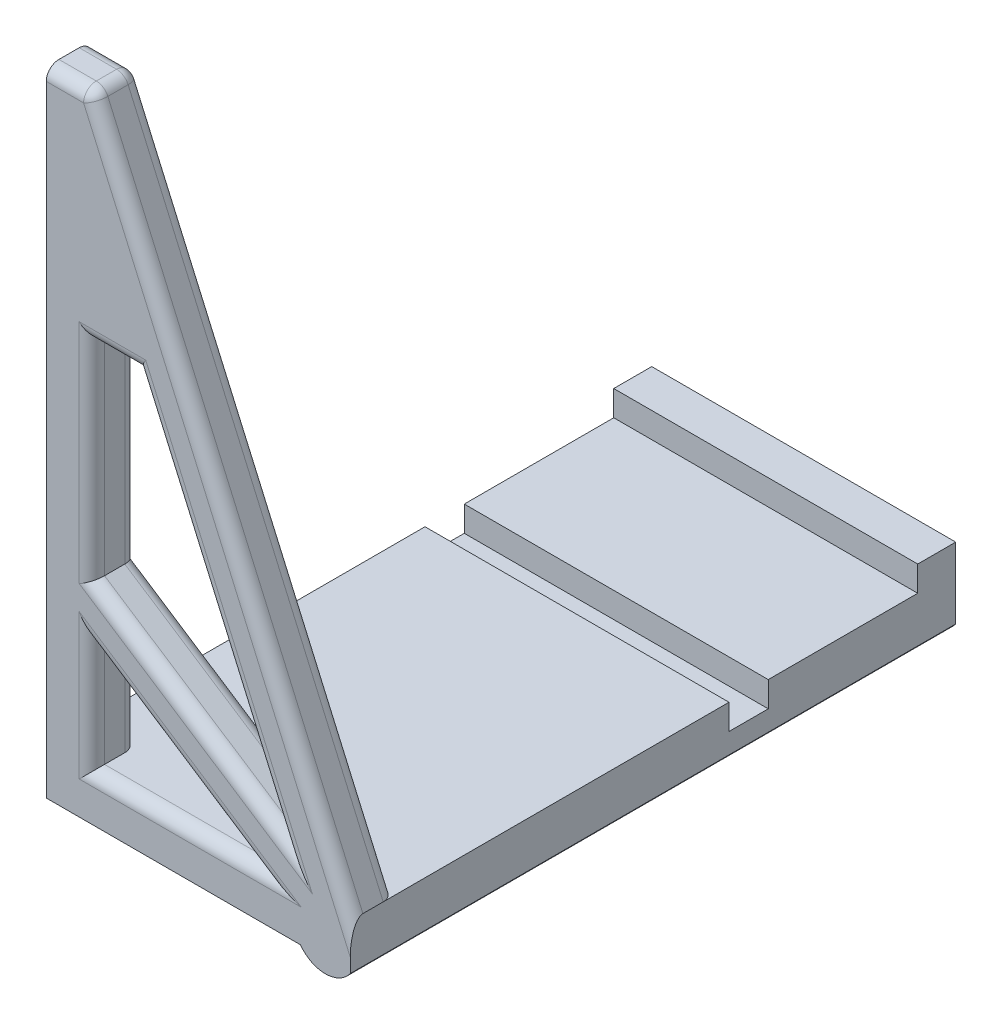
from build123d import *

# Parameters (mm, degrees)
EXTRUDE_1_DEPTH     = 120
SKETCH_2_W          = 15.5
SKETCH_2_H          = 10
CUT_EXTRUDE_1_DEPTH = 324.916484435
CUT_EXTRUDE_2_DEPTH = 40
CUT_EXTRUDE_3_DEPTH = 40
FILLET_16_R         = 5
EXTRUDE_2_DEPTH     = 239
EXTRUDE_3_DEPTH     = 18
FILLET_17_R         = 5


with BuildPart() as part:
    # 草圖1 → 填料-伸長1 (new body)
    with BuildSketch(Plane(origin=(0, 0, 0), x_dir=(0, 0, -1), z_dir=(1, 0, 0))):
        Polygon((-179.666666667, 241.333333333), (-179.666666667, -8.666666667), (59.333333333, -8.666666667), (59.333333333, 9.333333333), (59.333333333, 19.333333333), (44.333333333, 19.333333333), (44.333333333, 9.333333333), (-161.666666667, 9.333333333), (-161.666666667, 241.333333333), align=None)
    extrude(amount=EXTRUDE_1_DEPTH)

    # 草圖2 → 除料-伸長1 (cut, through all)
    with BuildSketch(Plane(origin=(120, 0, 0), x_dir=(0, 0, -1), z_dir=(1, 0, 0))):
        with Locations((-22.416666667, 4.333333333)):
            Rectangle(SKETCH_2_W, SKETCH_2_H)
    extrude(amount=-CUT_EXTRUDE_1_DEPTH, mode=Mode.SUBTRACT)

    # 草圖4 → 除料-伸長2 (cut)
    with BuildSketch(Plane.XY.offset(179.666666667)):
        Polygon((120, 241.333333333), (18, 241.333333333), (120, 9.333333333), align=None)
    extrude(amount=-CUT_EXTRUDE_2_DEPTH, mode=Mode.SUBTRACT)

    # 草圖5 → 除料-伸長3 (cut)
    with BuildSketch(Plane.XY.offset(179.666666667)):
        Polygon((36, 155.668785671), (100.337138528, 9.333333333), (18, 9.333333333), (18, 155.668785671), align=None)
    extrude(amount=-CUT_EXTRUDE_3_DEPTH, mode=Mode.SUBTRACT)

    # 圓角16
    # the kernel refuses this fillet: 5 mm, written as the material it takes off along each edge
    with BuildSketch(Plane(origin=(14.736369898, 236.333333333, 166.666666667), x_dir=(0.9154313590233789, 0.40247413198441667, 0), z_dir=(0, 0, -1))) as fillet_16_piece_1_section:
        Polygon((0, 0), (FILLET_16_R, 0), (FILLET_16_R, -FILLET_16_R * 0.652726020499), (FILLET_16_R * 0.402474131984, -FILLET_16_R * 0.915431359023), align=None)
    fillet_16_piece_1 = extrude(amount=FILLET_16_R, mode=Mode.PRIVATE)
    fillet_16_piece_1 = fillet_16_piece_1 - Plane(origin=(14.736369898, 236.333333333, 166.666666667), x_dir=(-0.5465921093537591, -0.8373989885306815, 0), z_dir=(0, 0, -1)) * Sphere(FILLET_16_R, mode=Mode.PRIVATE)
    add(fillet_16_piece_1, mode=Mode.SUBTRACT)
    with BuildSketch(Plane(origin=(14.736369898, 236.333333333, 174.666666667), x_dir=(0, 1, 0), z_dir=(0, 0, 1))) as fillet_16_piece_2_section:
        Polygon((0, 0), (FILLET_16_R, 0), (FILLET_16_R, -FILLET_16_R * 0.652726020499), (FILLET_16_R * 0.402474131984, -FILLET_16_R * 0.915431359023), align=None)
    fillet_16_piece_2 = extrude(amount=FILLET_16_R, mode=Mode.PRIVATE)
    fillet_16_piece_2 = fillet_16_piece_2 - Plane(origin=(14.736369898, 236.333333333, 174.666666667), x_dir=(-0.5465921093537591, -0.8373989885306815, 0), z_dir=(0, 0, 1)) * Sphere(FILLET_16_R, mode=Mode.PRIVATE)
    add(fillet_16_piece_2, mode=Mode.SUBTRACT)
    with BuildSketch(Plane(origin=(-12.5, 241.333333333, 161.666666667), x_dir=(0, 0, 1), z_dir=(1, 0, 0)), Plane(origin=(-12.5, 241.333333333, 179.666666667), x_dir=(0, -1, 0), z_dir=(1, 0, 0))) as fillet_16_piece_3:
        with BuildLine():
            CenterArc((FILLET_16_R, FILLET_16_R), FILLET_16_R, 180, 90)
            Line((0, FILLET_16_R), (0, 0))
            Line((0, 0), (FILLET_16_R, 0))
        make_face()
    extrude(amount=27.236369898, mode=Mode.SUBTRACT)
    with BuildSketch(Plane(origin=(18, 241.333333333, 174.666666667), x_dir=(-1, 0, 0), z_dir=(0, 0, -1))) as fillet_16_piece_4:
        with BuildLine():
            CenterArc((FILLET_16_R * 0.652726020499, -FILLET_16_R), FILLET_16_R, 90, 66.267060196)
            Line((-FILLET_16_R * 0.262705338524, -FILLET_16_R * 0.597525868016), (0, 0))
            Line((0, 0), (FILLET_16_R * 0.652726020499, 0))
        make_face()
    extrude(amount=8, mode=Mode.SUBTRACT)
    with BuildSketch(Plane(origin=(19.313526693, 238.345703993, 161.666666667), x_dir=(0, 0, 1), z_dir=(0.40247413198441667, -0.9154313590233789, 0))) as fillet_16_piece_5_section:
        with BuildLine():
            CenterArc((FILLET_16_R, FILLET_16_R), FILLET_16_R, 180, 90)
            Line((0, FILLET_16_R), (0, 0))
            Line((0, 0), (FILLET_16_R, 0))
        make_face()
    fillet_16_piece_5 = extrude(amount=262.668806653, mode=Mode.PRIVATE)
    fillet_16_piece_5 = split(fillet_16_piece_5, bisect_by=Plane(origin=(68.522420019, 9.333333333, 162.799850977), z_dir=(0, 1, 0)), keep=Keep.TOP, mode=Mode.PRIVATE)
    add(fillet_16_piece_5, mode=Mode.SUBTRACT)
    with BuildSketch(Plane(origin=(19.313526693, 238.345703993, 179.666666667), x_dir=(-0.9154313590233789, -0.40247413198441667, 5.6843418860808026e-15), z_dir=(0.40247413198441667, -0.9154313590233789, 0))) as fillet_16_piece_6:
        with BuildLine():
            CenterArc((FILLET_16_R, FILLET_16_R), FILLET_16_R, 180, 90)
            Line((0, FILLET_16_R), (0, 0))
            Line((0, 0), (FILLET_16_R, 0))
        make_face()
    extrude(amount=262.668806653, mode=Mode.SUBTRACT)

    # 草圖8 → 填料-伸長2 (add)
    with BuildSketch(Plane.XY.offset(179.666666667)):
        with BuildLine():
            ThreePointArc((110.17, -13.666666712), (115.684274668, -12.344840676), (120, -8.666666667))
            Line((120, -8.666666667), (110.17, -8.666666667))
            Line((110.17, -8.666666667), (110.17, -13.666666667))
        make_face()
        with BuildLine():
            Line((110.17, -13.666666667), (110.17, -8.666666667))
            Line((110.17, -8.666666667), (100.34, -8.666666667))
            ThreePointArc((100.34, -8.666666667), (104.655725332, -12.344840676), (110.17, -13.666666712))
        make_face()
        with BuildLine():
            ThreePointArc((110.17, -13.666666712), (115.684274668, -12.344840676), (120, -8.666666667))
            Line((120, -8.666666667), (110.17, -8.666666667))
            Line((110.17, -8.666666667), (110.17, -13.666666667))
        make_face()
        with BuildLine():
            Line((110.17, -13.666666667), (110.17, -8.666666667))
            Line((110.17, -8.666666667), (100.34, -8.666666667))
            ThreePointArc((100.34, -8.666666667), (104.655725332, -12.344840676), (110.17, -13.666666712))
        make_face()
    extrude(amount=-EXTRUDE_2_DEPTH)

    # 草圖9 → 填料-伸長3 (add)
    with BuildSketch(Plane.XY.offset(179.666666667)):
        Polygon((18, 63.079938443), (100.337138528, 9.333333333), (93.709875708, 24.407107589), (22.919522331, 70.616403134), (18, 73.827683351), align=None)
        Polygon((18, 52.332193536), (83.872125352, 9.333333333), (100.337138528, 9.333333333), (18, 63.079938443), align=None)
        Polygon((100.337138528, 9.333333333), (83.872125352, 9.333333333), (95.417616197, 1.796868643), align=None)
        Polygon((93.711170014, 24.406262715), (100.337138528, 9.333333333), (105.256660859, 16.869798024), align=None)
        Polygon((10.463535309, 67.999460774), (18, 63.079938443), (18, 73.827683351), (15.38305764, 75.535925465), align=None)
        Polygon((13.080477669, 55.543473753), (18, 52.332193536), (18, 63.079938443), align=None)
    extrude(amount=-EXTRUDE_3_DEPTH)

    # 圓角17
    fillet_17_edges = [part.edges().sort_by_distance(p)[0] for p in [
        (18, 30.832763435, 179.666666667),
        (18, 30.832763435, 161.666666667),
        (64.854937854, 90.03794663, 179.666666667),
        (64.854937854, 90.03794663, 161.666666667),
        (50.936062676, 30.832763435, 179.666666667),
        (55.854937854, 49.11739547, 179.666666667),
        (55.854937854, 49.11739547, 161.666666667),
        (50.936062676, 30.832763435, 161.666666667),
        (18, 114.748234511, 161.666666667),
        (27, 155.668785671, 161.666666667),
        (27, 155.668785671, 179.666666667),
        (18, 114.748234511, 179.666666667),
        (50.936062676, 9.333333333, 179.666666667),
    ]]
    fillet(fillet_17_edges, radius=FILLET_17_R)


solid = part.part
